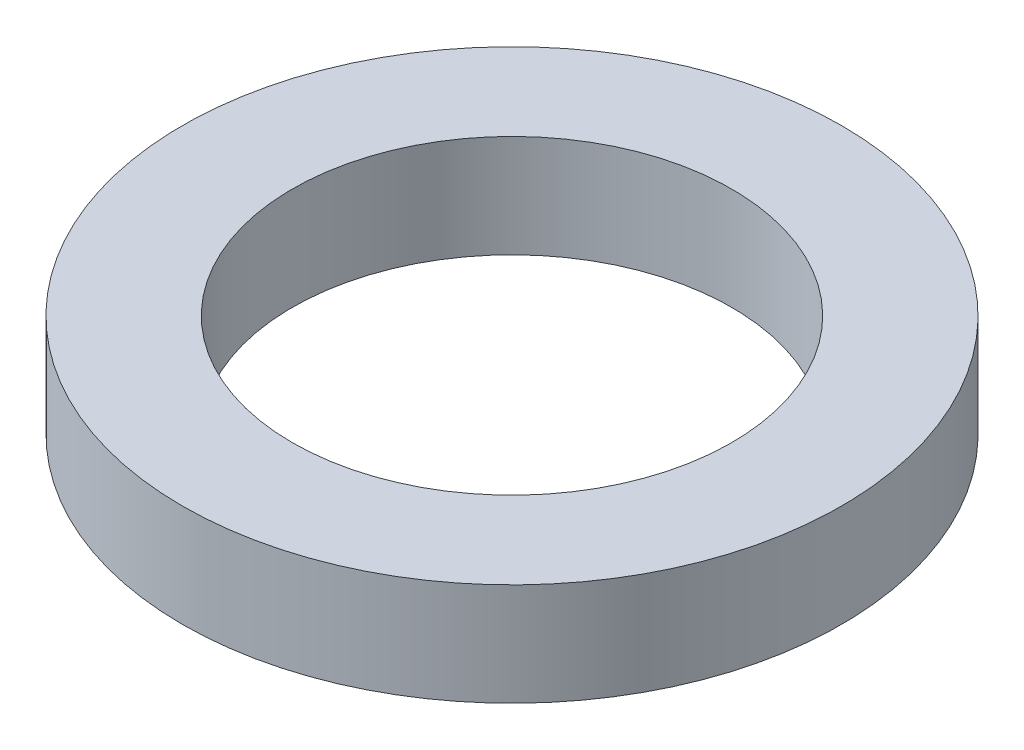
from build123d import *

# Parameters (mm, degrees)
SKETCH1_R           = 22.5
BOSS_EXTRUDE1_DEPTH = 7
SKETCH2_R           = 15
CUT_EXTRUDE1_DEPTH  = 33.580669115


with BuildPart() as part:
    # Sketch1 → Boss-Extrude1 (new body)
    with BuildSketch(Plane(origin=(0, 0, 0), x_dir=(1, 0, 0), z_dir=(0, 1, 0))):
        Circle(SKETCH1_R)
    extrude(amount=BOSS_EXTRUDE1_DEPTH)

    # Sketch2 → Cut-Extrude1 (cut, through all)
    with BuildSketch(Plane(origin=(0, 0, 0), x_dir=(1, 0, 0), z_dir=(0, 1, 0))):
        Circle(SKETCH2_R)
    extrude(amount=CUT_EXTRUDE1_DEPTH, mode=Mode.SUBTRACT)


solid = part.part
